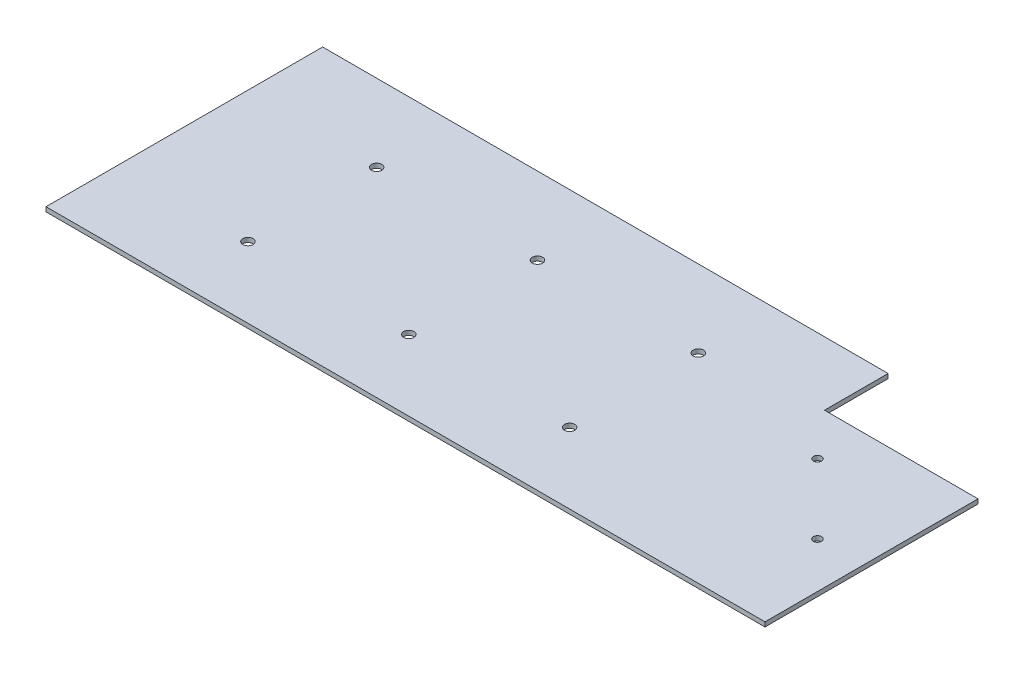
from build123d import *

# Parameters (mm, degrees)
BOSS_EXTRUDE1_DEPTH     = 3.5
CUT_EXTRUDE1_DEPTH      = 599.744260933
CUT_EXTRUDE1_DEPTH_BACK = 599.744260933
SKETCH2_R               = 4
SKETCH3_R               = 3.175
CUT_EXTRUDE2_DEPTH      = 10


with BuildPart() as part:
    # Sketch1 → Boss-Extrude1 (new body)
    with BuildSketch(Plane(origin=(0, 0, 0), x_dir=(1, 0, 0), z_dir=(0, 1, 0))):
        Polygon((0, 0), (0, 215), (439.5, 215), (439.5, 165.55), (558.8, 165.55), (558.8, 0), align=None)
    extrude(amount=BOSS_EXTRUDE1_DEPTH)

    # Sketch2 → Cut-Extrude1 (cut, two sides: drawn at the far end of the back side and taken through both)
    with BuildSketch(Plane(origin=(0, 3.5, 0), x_dir=(1, 0, 0), z_dir=(0, 1, 0)).offset(-CUT_EXTRUDE1_DEPTH_BACK)):
        with Locations((101.97168799, 155)):
            Circle(SKETCH2_R)
        with Locations((226.97168799, 155)):
            Circle(SKETCH2_R)
        with Locations((351.97168799, 155)):
            Circle(SKETCH2_R)
        with Locations((351.97168799, 55)):
            Circle(SKETCH2_R)
        with Locations((226.97168799, 55)):
            Circle(SKETCH2_R)
        with Locations((101.97168799, 55)):
            Circle(SKETCH2_R)
    extrude(amount=CUT_EXTRUDE1_DEPTH + CUT_EXTRUDE1_DEPTH_BACK, mode=Mode.SUBTRACT)

    # Sketch3 → Cut-Extrude2 (cut)
    with BuildSketch(Plane(origin=(0, 3.5, 0), x_dir=(1, 0, 0), z_dir=(0, 1, 0))):
        with Locations((469.459010849, 130.139772745)):
            Circle(SKETCH3_R)
        with Locations((523.459010849, 76.139772745)):
            Circle(SKETCH3_R)
    extrude(amount=-CUT_EXTRUDE2_DEPTH, mode=Mode.SUBTRACT)


solid = part.part
